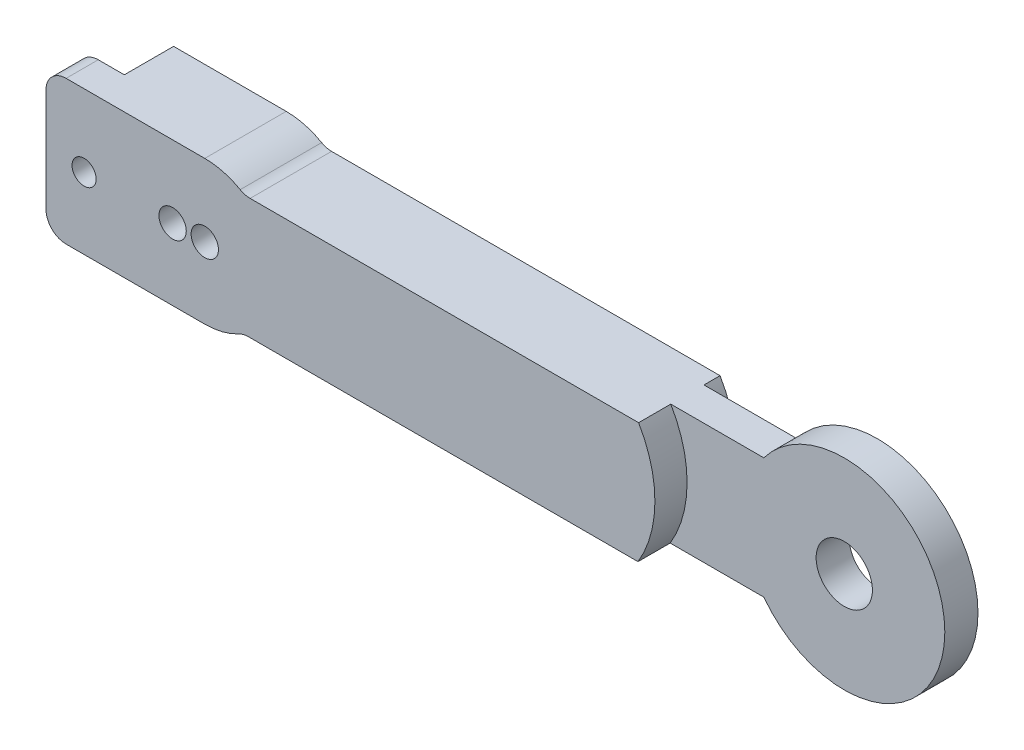
from build123d import *

# Parameters (mm, degrees)
BOSS_EXTRUDE1_DEPTH  = 4.125
BOSS_EXTRUDE2_START  = 2
BOSS_EXTRUDE2_DEPTH  = 2
SKETCH3_R            = 1.7
SKETCH3_R_2          = 1.5
BOSS_EXTRUDE3_DEPTH  = 4
BOSS_EXTRUDE4_DEPTH  = 4.125
FILLET2_R            = 2.5
SKETCH9_R            = 3.5
CUT_EXTRUDE1_DEPTH   = 99.03896228
SKETCH10_R           = 12.5
SKETCH10_R_2         = 7.5
BOSS_EXTRUDE9_DEPTH  = 4.125
BOSS_EXTRUDE11_DEPTH = 2
BOSS_EXTRUDE12_DEPTH = 4


with BuildPart() as part:
    # Sketch1 → Boss-Extrude1 (new body)
    with BuildSketch(Plane.XY):
        with BuildLine():
            Line((0, 0), (14, 0))
            ThreePointArc((14, 0), (17.925, 3.925), (14, 7.85))
            Line((14, 7.85), (0, 7.85))
            Line((0, 7.85), (0, 12.85))
            Line((0, 12.85), (14, 12.85))
            ThreePointArc((14, 12.85), (22.925, 3.925), (14, -5))
            Line((14, -5), (0, -5))
            Line((0, -5), (0, 0))
        make_face()
    extrude(amount=BOSS_EXTRUDE1_DEPTH)

    # Sketch2 → Boss-Extrude2 (add)
    with BuildSketch(Plane(origin=(0, 0, 0), x_dir=(-1, 0, 0), z_dir=(0, 0, -1)).offset(BOSS_EXTRUDE2_START)):
        with BuildLine():
            Line((-14, 6.7375), (0, 6.7375))
            Line((0, 6.7375), (0, 7.85))
            Line((0, 7.85), (0, 12.85))
            Line((0, 12.85), (-14, 12.85))
            ThreePointArc((-14, 12.85), (-22.925, 3.925), (-14, -5))
            Line((-14, -5), (0, -5))
            Line((0, -5), (0, 0))
            Line((0, 0), (0, 1.1125))
            Line((0, 1.1125), (-14, 1.1125))
            ThreePointArc((-14, 1.1125), (-16.8125, 3.925), (-14, 6.7375))
        make_face()
    extrude(amount=-BOSS_EXTRUDE2_DEPTH)

    # Sketch3 → Boss-Extrude3 (add)
    with BuildSketch(Plane.XY.offset(4.125)):
        with BuildLine():
            Line((0, 12.85), (-3.238869072, 12.85))
            ThreePointArc((-3.238869072, 12.85), (-5.006636025, 12.117766953), (-5.738869072, 10.35))
            Line((-5.738869072, 10.35), (-5.738869072, -2.5))
            ThreePointArc((-5.738869072, -2.5), (-5.006636025, -4.267766953), (-3.238869072, -5))
            Line((-3.238869072, -5), (0, -5))
            Line((0, -5), (14, -5))
            ThreePointArc((14, -5), (18.764286268, -3.621999494), (22.057381748, 0.086481488))
            Line((22.057381748, 0.086481488), (22.057381748, 7.763518512))
            ThreePointArc((22.057381748, 7.763518512), (18.764286268, 11.471999494), (14, 12.85))
            Line((14, 12.85), (0, 12.85))
        make_face()
        with Locations((14, 3.8625)):
            Circle(SKETCH3_R, mode=Mode.SUBTRACT)
        with Locations((10, 3.8625)):
            Circle(SKETCH3_R, mode=Mode.SUBTRACT)
        with Locations((-1, 3.8625)):
            Circle(SKETCH3_R_2, mode=Mode.SUBTRACT)
    extrude(amount=BOSS_EXTRUDE3_DEPTH)

    # Sketch4 → Boss-Extrude4 (add)
    with BuildSketch(Plane.XY):
        with BuildLine():
            Line((89.5, 11.3625), (18.721642326, 11.3625))
            ThreePointArc((18.721642326, 11.3625), (22.8625, 3.8625), (18.721642326, -3.6375))
            Line((18.721642326, -3.6375), (89.5, -3.6375))
            ThreePointArc((89.5, -3.6375), (97, 3.8625), (89.5, 11.3625))
        make_face()
    extrude(amount=BOSS_EXTRUDE4_DEPTH)

    # Fillet2
    # the kernel refuses this fillet: 2.5 mm, written as the material it adds along each edge
    with BuildSketch(Plane(origin=(18.739643315, -3.6375, 4.125), x_dir=(1, 0, 0), z_dir=(0, 0, -1))) as fillet2_piece_1:
        with BuildLine():
            CenterArc((0.671153184, 2.5), FILLET2_R, 241.732240209, 28.267759791)
            ThreePointArc((-0.512828544, 0.298140044), (-0.253936624, 0.153331807), (0, 0))
            Line((0, 0), (0.671153184, 0))
        make_face()
    extrude(amount=4.125)
    with BuildSketch(Plane(origin=(18.933479376, 11.3625, 4.125), x_dir=(1, 0, 0), z_dir=(0, 0, -1))) as fillet2_piece_2:
        with BuildLine():
            CenterArc((0.703604866, -2.5), FILLET2_R, 90, 29.564237734)
            ThreePointArc((-0.52989278, -0.325492341), (-0.262110566, -0.167362816), (0, 0))
            Line((0, 0), (0.703604866, 0))
        make_face()
    extrude(amount=4.125)

    # Sketch9 → Cut-Extrude1 (cut, through all)
    with BuildSketch(Plane.XY.offset(4.125)):
        with Locations((89.5, 3.8625)):
            Circle(SKETCH9_R)
    extrude(amount=-CUT_EXTRUDE1_DEPTH, mode=Mode.SUBTRACT)

    # Sketch10 → Boss-Extrude9 (add)
    with BuildSketch(Plane(origin=(0, 0, 0), x_dir=(-1, 0, 0), z_dir=(0, 0, -1))):
        with Locations((-89.5, 3.8625)):
            Circle(SKETCH10_R)
        with Locations((-89.5, 3.8625)):
            Circle(SKETCH10_R_2, mode=Mode.SUBTRACT)
    extrude(amount=-BOSS_EXTRUDE9_DEPTH)

    # Sketch12 → Boss-Extrude11 (add)
    with BuildSketch(Plane(origin=(0, 0, 0), x_dir=(-1, 0, 0), z_dir=(0, 0, -1))):
        with BuildLine():
            Line((-19.637084242, 11.3625), (-67.931783013, 11.3625))
            ThreePointArc((-67.931783013, 11.3625), (-69.959582845, 3.85224622), (-67.857301806, -3.6375))
            Line((-67.857301806, -3.6375), (-19.410796499, -3.6375))
            ThreePointArc((-19.410796499, -3.6375), (-18.800325324, -3.713180519), (-18.22681477, -3.935640044))
            ThreePointArc((-18.22681477, -3.935640044), (-22.924428786, 3.824025558), (-18.403586596, 11.687992341))
            ThreePointArc((-18.403586596, 11.687992341), (-18.999224205, 11.445242344), (-19.637084242, 11.3625))
        make_face()
    extrude(amount=BOSS_EXTRUDE11_DEPTH)

    # Sketch13 → Boss-Extrude12 (add)
    with BuildSketch(Plane.XY.offset(4.125)):
        with BuildLine():
            Line((67.931783013, 11.3625), (19.637084242, 11.3625))
            ThreePointArc((19.637084242, 11.3625), (18.999224205, 11.445242344), (18.403586596, 11.687992341))
            ThreePointArc((18.403586596, 11.687992341), (20.532174732, 10.006637795), (22.057381748, 7.763518512))
            Line((22.057381748, 7.763518512), (22.057381748, 0.086481488))
            ThreePointArc((22.057381748, 0.086481488), (20.462951062, -2.230151385), (18.22681477, -3.935640044))
            ThreePointArc((18.22681477, -3.935640044), (18.800325324, -3.713180519), (19.410796499, -3.6375))
            Line((19.410796499, -3.6375), (67.857301806, -3.6375))
            ThreePointArc((67.857301806, -3.6375), (69.959582845, 3.85224622), (67.931783013, 11.3625))
        make_face()
    extrude(amount=BOSS_EXTRUDE12_DEPTH)


solid = part.part
